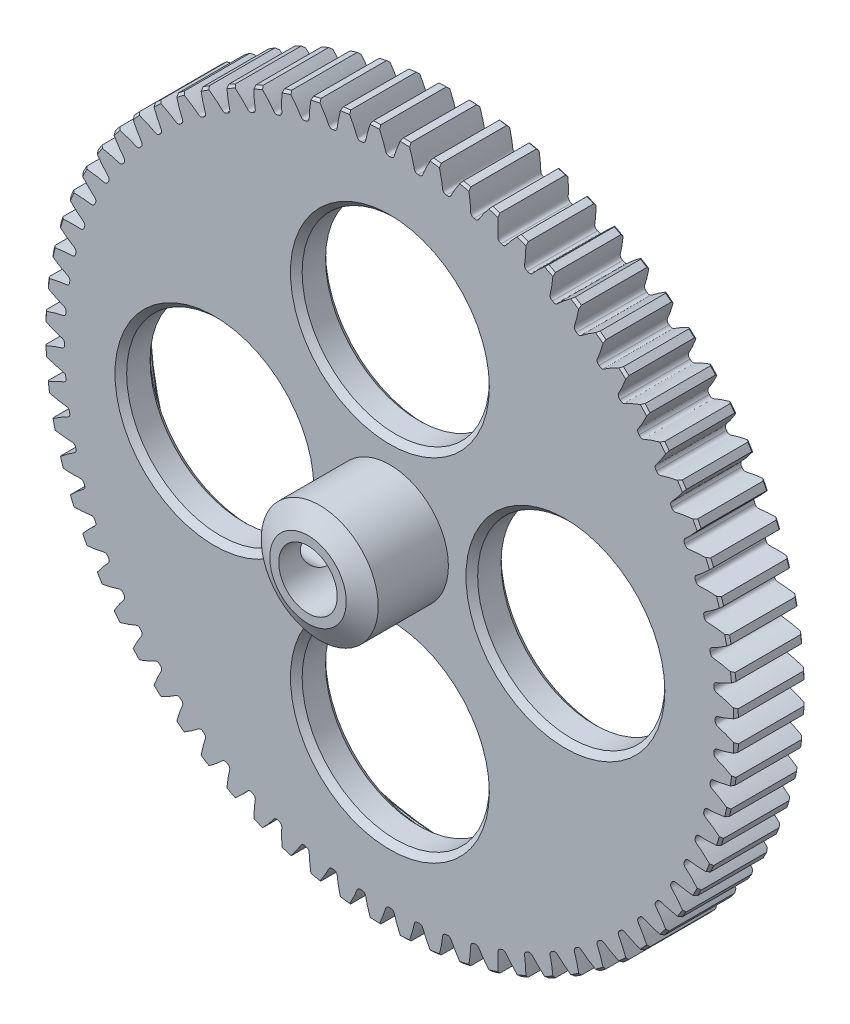
from build123d import *

# Parameters (mm, degrees)
GEAR_BASESKETCH_R                            = 29.6
F_0_8_MODULE_57_6000MM_P_D_DEPTH             = 3
CHAMFER_449_SIZE                             = 0.2
TOOTH_CUT_COARSE_PITCH_INVOLUTE_20_DEG_DEPTH = 42.968083111
TOOTH_PATTERN_72_72_COUNT                    = 72
SKETCH3_R                                    = 5
EXTRUDE_1521_DEPTH                           = 7
SKETCH4_R                                    = 2.5
CUT_EXTRUDE_1610_DEPTH                       = 13
SKETCH5_R                                    = 26
CUT_EXTRUDE_3875_DEPTH                       = 3
SKETCH6_R                                    = 8
CUT_EXTRUDE_5091_DEPTH                       = 3
CIRPATTERN2_COUNT                            = 4
CHAMFER_6695_SIZE                            = 0.5
SKETCH7_R                                    = 1.65
CUT_EXTRUDE_7081_DEPTH                       = 5
CHAMFER_7892_SIZE                            = 1.732050808
CHAMFER_7892_SIZE2                           = 1


with BuildPart() as part:
    # Gear-BaseSketch → 0.8 Module, 57,6000mm P.D. (new, symmetric)
    with BuildSketch(Plane.XY):
        Circle(GEAR_BASESKETCH_R)
    extrude(amount=F_0_8_MODULE_57_6000MM_P_D_DEPTH, both=True)

    # Chamfer 449
    chamfer_449_edges = [part.edges().sort_by_distance(p)[0] for p in [
        (-29.6, 0, -3),
        (-29.6, 0, 3),
    ]]
    chamfer(chamfer_449_edges, length=CHAMFER_449_SIZE)

    # Tooth-Sketch; Backlash: 0,0000mm → Tooth-Cut, Coarse Pitch Involute 20 deg (cut, symmetric)
    with BuildSketch(Plane.XY):
        with BuildLine():
            ThreePointArc((-1.024258536, 29.687633444), (0, 29.705297256), (1.024258536, 29.687633444))
            add(Edge.make_bspline(
                [(1.024258536, 29.687633444), (0.979610694, 29.597391317), (0.915246561, 29.463166425), (0.834108862, 29.28523032), (0.777588717, 29.156996547), (0.724405872, 29.032064454), (0.674467196, 28.910497435), (0.627678477, 28.792357048), (0.583944463, 28.677703002), (0.543168941, 28.566593123), (0.505254598, 28.459083409), (0.470103653, 28.355227757), (0.437615779, 28.255078869), (0.407695541, 28.158684989), (0.386800638, 28.088259215), (0.374158333, 28.044308418), (0.368259462, 28.025726613), (0.362270369, 28.008833417), (0.35317317, 27.985798194), (0.339025123, 27.955595366), (0.315562556, 27.916939338), (0.279647406, 27.873923785), (0.184954137, 27.799686106), (0.074740504, 27.790839782), (0, 27.799844594)],
                knots=[0, 0, 0, 0, 0.133477495, 0.197328681, 0.259254826, 0.31925593, 0.377331993, 0.433483015, 0.487708996, 0.540009936, 0.590385836, 0.638836694, 0.685362511, 0.729963287, 0.772639022, 0.782749131, 0.790590414, 0.798480968, 0.806505601, 0.823418377, 0.842634912, 0.8662913, 0.897399291, 1, 1, 1, 1], degree=3))
            add(Edge.make_bspline(
                [(-1.024258536, 29.687633444), (-0.979610694, 29.597391317), (-0.915246561, 29.463166425), (-0.834108862, 29.28523032), (-0.777588717, 29.156996547), (-0.724405872, 29.032064454), (-0.674467196, 28.910497435), (-0.627678477, 28.792357048), (-0.583944463, 28.677703002), (-0.543168941, 28.566593123), (-0.505254598, 28.459083409), (-0.470103653, 28.355227757), (-0.437615779, 28.255078869), (-0.407695541, 28.158684989), (-0.386800638, 28.088259215), (-0.374158333, 28.044308418), (-0.368259462, 28.025726613), (-0.362270369, 28.008833417), (-0.35317317, 27.985798194), (-0.339025123, 27.955595366), (-0.315562556, 27.916939338), (-0.279647406, 27.873923785), (-0.184954137, 27.799686106), (-0.074740504, 27.790839782), (0, 27.799844594)],
                knots=[0, 0, 0, 0, 0.133477495, 0.197328681, 0.259254826, 0.31925593, 0.377331993, 0.433483015, 0.487708996, 0.540009936, 0.590385836, 0.638836694, 0.685362511, 0.729963287, 0.772639022, 0.782749131, 0.790590414, 0.798480968, 0.806505601, 0.823418377, 0.842634912, 0.8662913, 0.897399291, 1, 1, 1, 1], degree=3))
        make_face()
    tooth_cut_coarse_pitch_involute_20_deg = extrude(amount=TOOTH_CUT_COARSE_PITCH_INVOLUTE_20_DEG_DEPTH, both=True, mode=Mode.SUBTRACT)

    # Tooth Pattern, 72 / 72: Tooth-Cut, Coarse Pitch Involute 20 deg ×72 about axis
    tooth_pattern_72_72_axis = Axis((0, 0, -7.134023518), (0, 0, 1))
    for i in range(1, TOOTH_PATTERN_72_72_COUNT):
        add(tooth_cut_coarse_pitch_involute_20_deg.rotate(tooth_pattern_72_72_axis, i * 360 / TOOTH_PATTERN_72_72_COUNT), mode=Mode.SUBTRACT)

    # Sketch3 → Extrude 1521 (add)
    with BuildSketch(Plane.XY.offset(3)):
        Circle(SKETCH3_R)
    extrude(amount=EXTRUDE_1521_DEPTH)

    # Sketch4 → Cut-Extrude 1610 (cut)
    with BuildSketch(Plane.XY.offset(10)):
        Circle(SKETCH4_R)
    extrude(amount=-CUT_EXTRUDE_1610_DEPTH, mode=Mode.SUBTRACT)

    # Sketch5 → Cut-Extrude 3875 (cut)
    with BuildSketch(Plane(origin=(0, 0, -3), x_dir=(-1, 0, 0), z_dir=(0, 0, -1))):
        Circle(SKETCH5_R)
    extrude(amount=-CUT_EXTRUDE_3875_DEPTH, mode=Mode.SUBTRACT)

    # Sketch6 → Cut-Extrude 5091 (cut)
    with BuildSketch(Plane(origin=(0, 0, 0), x_dir=(-1, 0, 0), z_dir=(0, 0, -1))):
        with Locations((0, 15)):
            Circle(SKETCH6_R)
    cut_extrude_5091 = extrude(amount=-CUT_EXTRUDE_5091_DEPTH, mode=Mode.SUBTRACT)

    # CirPattern2: Cut-Extrude 5091 ×4 about axis
    cirpattern2_axis = Axis((0, 0, 0), (0, 0, 1))
    for i in range(1, CIRPATTERN2_COUNT):
        add(cut_extrude_5091.rotate(cirpattern2_axis, i * 360 / CIRPATTERN2_COUNT), mode=Mode.SUBTRACT)

    # Chamfer 6695
    chamfer_6695_edges = [part.edges().sort_by_distance(p)[0] for p in [
        (26, 0, -3),
        (-2.5, 0, 0),
        (8, 15, 3),
        (8, 15, 0),
        (-15, 8, 3),
        (-15, 8, 0),
        (-8, -15, 3),
        (-8, -15, 0),
        (15, -8, 3),
        (15, -8, 0),
    ]]
    chamfer(chamfer_6695_edges, length=CHAMFER_6695_SIZE)

    # Sketch7 → Cut-Extrude 7081 (cut)
    with BuildSketch(Plane.ZY.offset(5)):
        with Locations(Location((6.5, 0, 0), (0, 0, 270))):
            Circle(SKETCH7_R)
    extrude(amount=-CUT_EXTRUDE_7081_DEPTH, mode=Mode.SUBTRACT)

    # Chamfer 7892
    chamfer_7892_edges = [part.edges().sort_by_distance(p)[0] for p in [
        (-5, 0, 10),
    ]]
    chamfer_7892_side = [part.faces().sort_by_distance(p)[0] for p in [
        (-4.858578644, 0, 10),
    ]]
    chamfer(chamfer_7892_edges, length=CHAMFER_7892_SIZE, length2=CHAMFER_7892_SIZE2, reference=chamfer_7892_side[0])


solid = part.part
